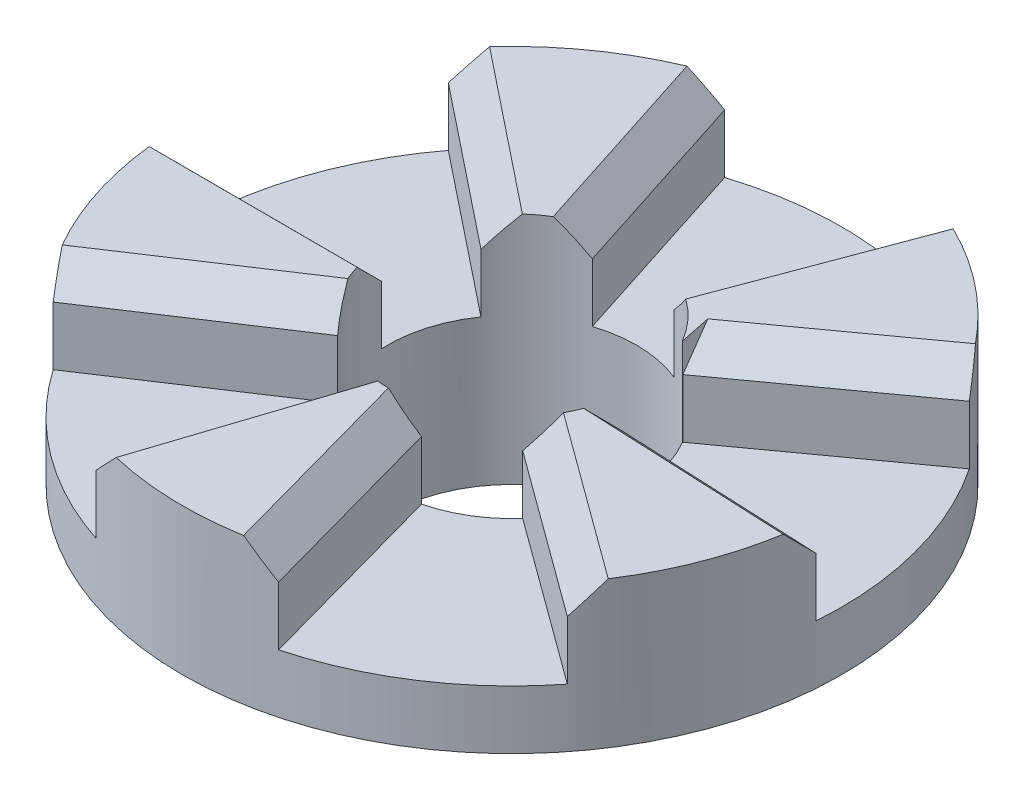
from build123d import *

# Parameters (mm, degrees)
SKETCH1_R           = 11.25
SKETCH1_R_2         = 4.25
BOSS_EXTRUDE1_DEPTH = 5
CUT_EXTRUDE2_DEPTH  = 3
BOSS_EXTRUDE2_START = 3
SKETCH4_R           = 6.620764517
SKETCH4_R_2         = 4.25
BOSS_EXTRUDE2_DEPTH = 3
CHAMFER1_SIZE       = 1
CHAMFER2_SIZE       = 1


with BuildPart() as part:
    # Sketch1 → Boss-Extrude1 (new body)
    with BuildSketch(Plane(origin=(0, 0, 0), x_dir=(1, 0, 0), z_dir=(0, 1, 0))):
        Circle(SKETCH1_R)
        Circle(SKETCH1_R_2, mode=Mode.SUBTRACT)
    extrude(amount=BOSS_EXTRUDE1_DEPTH)

    # Sketch3 → Cut-Extrude2 (cut)
    with BuildSketch(Plane(origin=(0, 5, 0), x_dir=(1, 0, 0), z_dir=(0, 1, 0))):
        Polygon((-1.30240431, 4.045521352), (-3.447540821, 10.708732992), (-2.814473121, 12.113337276), (3.473976473, 11.68177701), (4.052459179, 10.494764152), (1.595322963, 3.939218786), align=None)
        with BuildLine():
            Line((3.66281977, 2.16879653), (9.43886273, 6.341556956))
            ThreePointArc((9.43886273, 6.341556956), (11.095464323, 2.918099763), (11.552993728, -0.857486924))
            Line((11.552993728, -0.857486924), (4.216677561, -0.531159435))
            Line((4.216677561, -0.531159435), (3.66281977, 2.16879653))
        make_face()
        with BuildLine():
            Line((3.182121314, -2.817197889), (9.267549198, -7.263672725))
            ThreePointArc((9.267549198, -7.263672725), (6.523565971, -9.897100916), (3.074154011, -11.498957689))
            Line((3.074154011, -11.498957689), (1.034866519, -4.122080941))
            Line((1.034866519, -4.122080941), (3.182121314, -2.817197889))
        make_face()
        with BuildLine():
            Line((-1.340240362, -4.033144651), (-3.724731939, -11.304991057))
            ThreePointArc((-3.724731939, -11.304991057), (-7.077208431, -9.509081993), (-9.666591669, -6.723497237))
            Line((-9.666591669, -6.723497237), (-3.383323403, -2.572085293))
            Line((-3.383323403, -2.572085293), (-1.340240362, -4.033144651))
        make_face()
        with BuildLine():
            Line((-4.210073716, -0.217340235), (-11.583089741, -0.197433465))
            ThreePointArc((-11.583089741, -0.197433465), (-10.911050932, 3.545927569), (-9.061965823, 6.8693704))
            Line((-9.061965823, 6.8693704), (-3.488025994, 2.428204))
            Line((-3.488025994, 2.428204), (-4.210073716, -0.217340235))
        make_face()
    extrude(amount=-CUT_EXTRUDE2_DEPTH, mode=Mode.SUBTRACT)

    # Sketch4 → Boss-Extrude2 (add)
    with BuildSketch(Plane.XZ.offset(BOSS_EXTRUDE2_START)):
        Circle(SKETCH4_R)
        Circle(SKETCH4_R_2, mode=Mode.SUBTRACT)
    extrude(amount=-BOSS_EXTRUDE2_DEPTH)

    # Chamfer1
    chamfer1_edges = [part.edges().sort_by_distance(p)[0] for p in [
        (2.823891071, 5, -7.216991469),
    ]]
    chamfer(chamfer1_edges, length=CHAMFER1_SIZE)

    # Chamfer2
    chamfer2_edges = [part.edges().sort_by_distance(p)[0] for p in [
        (-2.374972565, 5, -7.377127172),
        (-6.22753029, 5, -4.610967862),
        (-7.746347682, 5, 0.207792474),
        (-6.305917974, 5, 4.503069853),
        (-2.430786424, 5, 7.358920066),
        (1.967538953, 5, 7.495911074),
        (6.01279724, 5, 4.885504262),
        (7.71753923, 5, 0.686881649),
        (6.501631486, 5, -4.219626357),
    ]]
    chamfer(chamfer2_edges, length=CHAMFER2_SIZE)


solid = part.part
